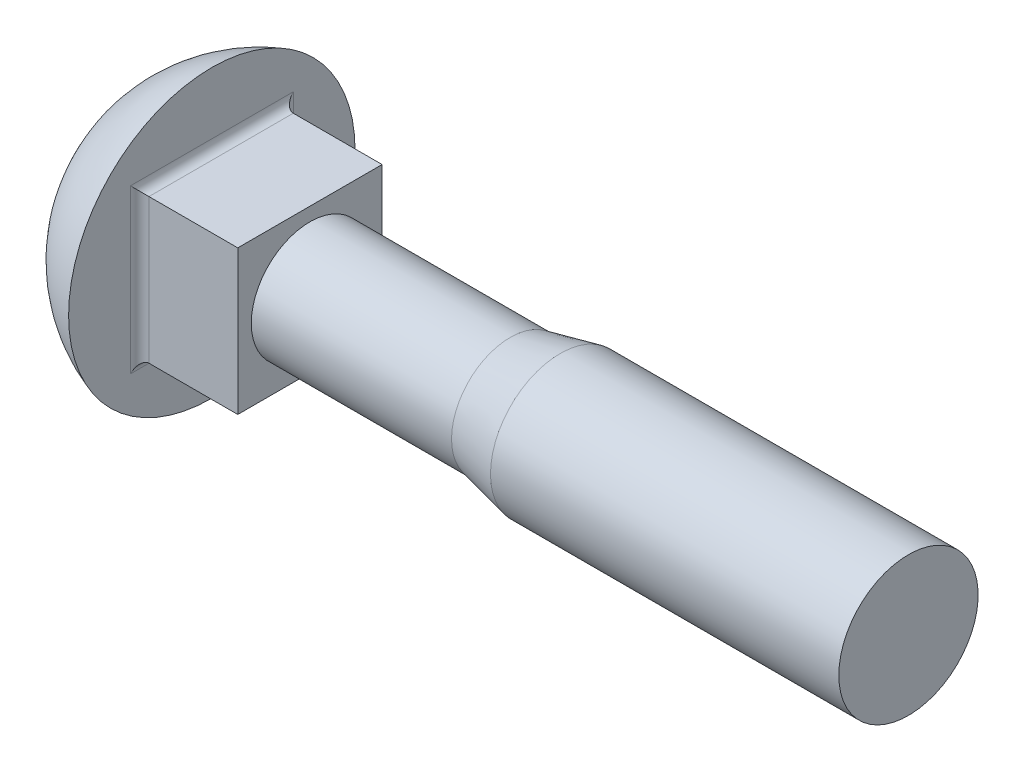
from build123d import *

# Parameters (mm, degrees)
SKETCH2_W    = 12.43
SKETCH2_H    = 12.43
NECK_DEPTH   = 8.45
HEADFILLET_R = 0.8


with BuildPart() as part:
    # Sketch1 → Base (revolve)
    with BuildSketch(Plane.XY):
        with BuildLine():
            Line((68.9, 0), (68.9, 6))
            Line((68.9, 6), (8.9, 6))
            Line((8.9, 6), (8.9, 12.336531117))
            ThreePointArc((8.9, 12.336531117), (2.457229966, 7.605918748), (0, 0))
            Line((0, 0), (68.9, 0))
        make_face()
    revolve(axis=Axis((-31.484345479, 0, 0), (1, 0, 0)))

    # Sketch2 → Neck (add)
    with BuildSketch(Plane(origin=(8.9, 0, 0), x_dir=(0, 0, -1), z_dir=(1, 0, 0))):
        Rectangle(SKETCH2_W, SKETCH2_H)
    extrude(amount=NECK_DEPTH)

    # Sketch5 → Cut-Revolve1 (revolve, cut)
    with BuildSketch(Plane.XY):
        Polygon((17.35, 5.053), (34.6, 5.053), (38.9, 6), (17.35, 6), align=None)
    revolve(axis=Axis((0, 0, 0), (1, 0, 0)), mode=Mode.SUBTRACT)

    # HeadFillet
    headfillet_edges = [part.edges().sort_by_distance(p)[0] for p in [
        (8.9, 0, -6.215),
        (8.9, -6.215, 0),
        (8.9, 0, 6.215),
        (8.9, 6.215, 0),
    ]]
    fillet(headfillet_edges, radius=HEADFILLET_R)


solid = part.part
